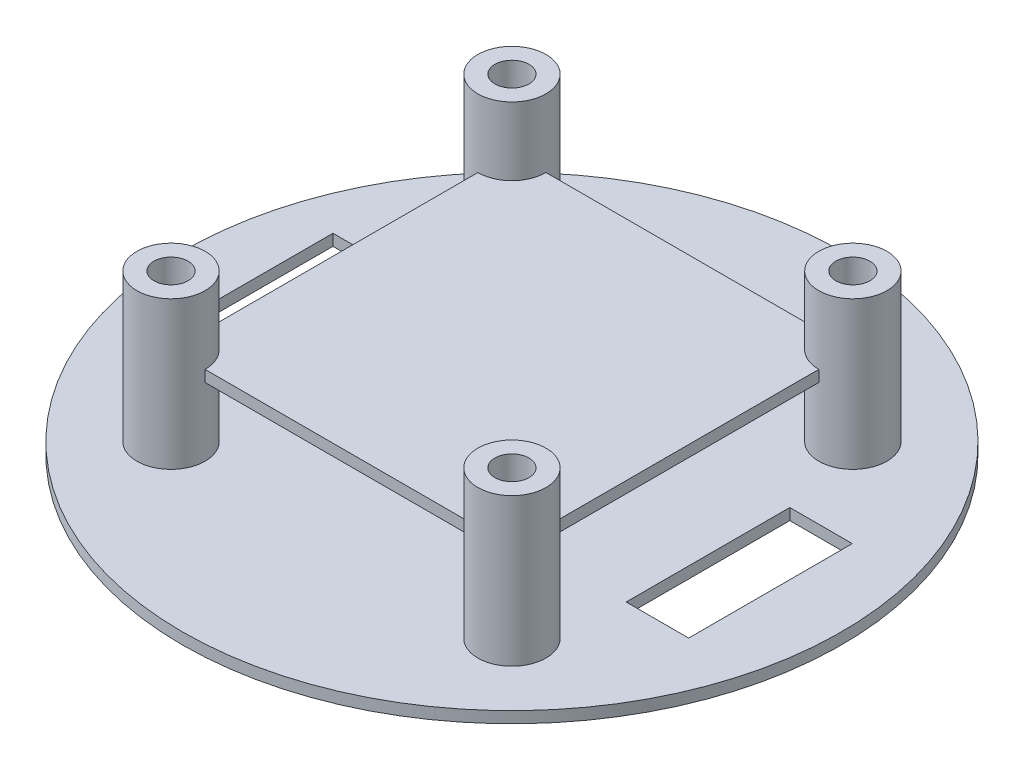
from build123d import *

# Parameters (mm, degrees)
CROQUIS1_R              = 29
SALIENTE_EXTRUIR1_DEPTH = 1
CROQUIS2_R              = 3
SALIENTE_EXTRUIR2_DEPTH = 7
SALIENTE_EXTRUIR3_START = -1
SALIENTE_EXTRUIR3_DEPTH = 1
CROQUIS4_R              = 3
SALIENTE_EXTRUIR4_DEPTH = 6
CROQUIS5_R              = 1.5
CORTAR_EXTRUIR1_DEPTH   = 6
CORTAR_EXTRUIR2_REACH   = 45.336
CROQUIS6_W              = 5.5
CROQUIS6_H              = 14.4
CROQUIS6_W_2            = 7.5
CROQUIS6_H_2            = 16


with BuildPart() as part:
    # Croquis1 → Saliente-Extruir1 (new body)
    with BuildSketch(Plane(origin=(0, 0, 0), x_dir=(1, 0, 0), z_dir=(0, 1, 0))):
        Circle(CROQUIS1_R)
    extrude(amount=SALIENTE_EXTRUIR1_DEPTH)

    # Croquis2 → Saliente-Extruir2 (add)
    with BuildSketch(Plane(origin=(0, 1, 0), x_dir=(1, 0, 0), z_dir=(0, 1, 0))):
        with Locations((-15, 15)):
            Circle(CROQUIS2_R)
        with Locations((15, 15)):
            Circle(CROQUIS2_R)
        with Locations((-15, -15)):
            Circle(CROQUIS2_R)
        with Locations((15, -15)):
            Circle(CROQUIS2_R)
    extrude(amount=SALIENTE_EXTRUIR2_DEPTH)

    # Croquis3 → Saliente-Extruir3 (add)
    with BuildSketch(Plane(origin=(0, 8, 0), x_dir=(1, 0, 0), z_dir=(0, 1, 0)).offset(SALIENTE_EXTRUIR3_START)):
        with BuildLine():
            Line((-15, -12), (-15, 12))
            ThreePointArc((-15, 12), (-12.878679656, 12.878679656), (-12, 15))
            Line((-12, 15), (12, 15))
            ThreePointArc((12, 15), (12.878679656, 12.878679656), (15, 12))
            Line((15, 12), (15, -12))
            ThreePointArc((15, -12), (12.878679656, -12.878679656), (12, -15))
            Line((12, -15), (-12, -15))
            ThreePointArc((-12, -15), (-12.878679656, -12.878679656), (-15, -12))
        make_face()
    extrude(amount=SALIENTE_EXTRUIR3_DEPTH)

    # Croquis4 → Saliente-Extruir4 (add)
    with BuildSketch(Plane(origin=(0, 8, 0), x_dir=(1, 0, 0), z_dir=(0, 1, 0))):
        with Locations((15, 15)):
            Circle(CROQUIS4_R)
        with Locations((15, -15)):
            Circle(CROQUIS4_R)
        with Locations((-15, 15)):
            Circle(CROQUIS4_R)
        with Locations((-15, -15)):
            Circle(CROQUIS4_R)
    extrude(amount=SALIENTE_EXTRUIR4_DEPTH)

    # Croquis5 → Cortar-Extruir1 (cut)
    with BuildSketch(Plane(origin=(0, 14, 0), x_dir=(1, 0, 0), z_dir=(0, 1, 0))):
        with Locations((15, 15)):
            Circle(CROQUIS5_R)
        with Locations((15, -15)):
            Circle(CROQUIS5_R)
        with Locations((-15, -15)):
            Circle(CROQUIS5_R)
        with Locations((-15, 15)):
            Circle(CROQUIS5_R)
    extrude(amount=-CORTAR_EXTRUIR1_DEPTH, mode=Mode.SUBTRACT)

    # Croquis6 → Cortar-Extruir2 (cut, up to next)
    with BuildSketch(Plane.XZ, mode=Mode.PRIVATE) as cortar_extruir2_sk1:
        with Locations((20, 0)):
            Rectangle(CROQUIS6_W, CROQUIS6_H)
    cortar_extruir2_tool1 = extrude(cortar_extruir2_sk1.sketch, amount=-CORTAR_EXTRUIR2_REACH, mode=Mode.PRIVATE) & part.part
    # Croquis6 → Cortar-Extruir2 (cut, up to next)
    with BuildSketch(Plane.XZ, mode=Mode.PRIVATE) as cortar_extruir2_sk2:
        with Locations((-20, 0)):
            Rectangle(CROQUIS6_W_2, CROQUIS6_H_2)
    cortar_extruir2_tool2 = extrude(cortar_extruir2_sk2.sketch, amount=-CORTAR_EXTRUIR2_REACH, mode=Mode.PRIVATE) & part.part
    add(cortar_extruir2_tool1.solids().sort_by_distance((20, 0, 0))[0], mode=Mode.SUBTRACT)
    add(cortar_extruir2_tool2.solids().sort_by_distance((-20, 0, 0))[0], mode=Mode.SUBTRACT)


solid = part.part
